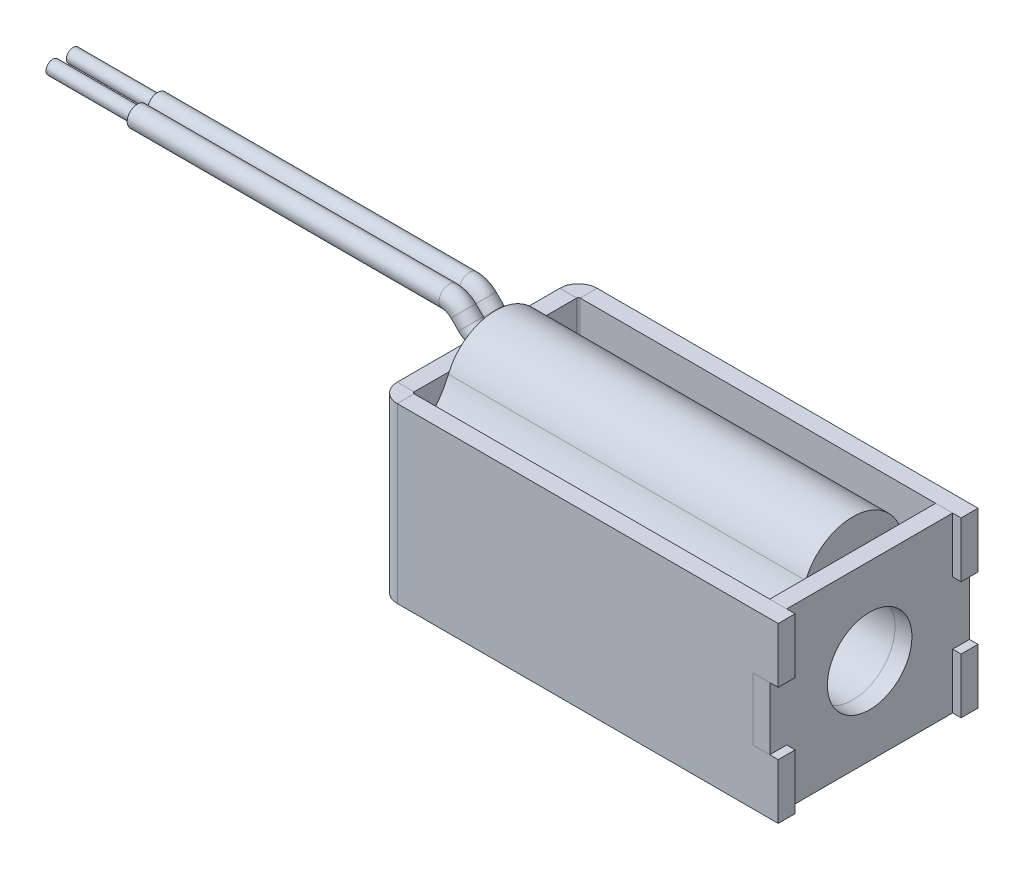
from build123d import *

# Parameters (mm, degrees)
T_LE_DE_BASE_PLI_E1_DEPTH = 6.5
ESQUISSE6_W               = 1.27
ESQUISSE6_H               = 4.699
ENL_V_MAT_EXTRU_1_DEPTH   = 1.905
BOSS_EXTRU_1_DEPTH        = 1.27
BOSS_EXTRU_2_DEPTH        = 26.825
CONG_1_R                  = 6.35
ESQUISSE9_R               = 0.762
ESQUISSE13_R              = 1.651
ENL_V_MAT_EXTRU_2_DEPTH   = 33.343199779
BOSS_EXTRU_3_START        = 0.381
ESQUISSE14_R              = 2.4765
ESQUISSE14_R_2            = 1.651
BOSS_EXTRU_3_DEPTH        = 0.381
ESQUISSE15_R              = 3.175
ENL_V_MAT_EXTRU_3_DEPTH   = 20
ESQUISSE17_R              = 0.508
BOSS_EXTRU_4_DEPTH        = 6.35
ESQUISSE19_R              = 1.143
ENL_V_MAT_EXTRU_7_DEPTH   = 1.27


# Read off the part's stored shape, not the designer's step: Boss.-Extru.2
# Sheet-metal steps are written as plain solids
with BuildPart() as part:
    # Esquisse1 → Tôle de base pliée1 (new, symmetric)
    with BuildSketch(Plane(origin=(0, 0, 0), x_dir=(1, 0, 0), z_dir=(0, 1, 0))):
        with BuildLine():
            Line((15, 7.5), (-13.603, 7.5))
            ThreePointArc((-13.603, 7.5), (-14.590828173, 7.090828173), (-15, 6.103))
            Line((-15, 6.103), (-15, -6.103))
            ThreePointArc((-15, -6.103), (-14.590828173, -7.090828173), (-13.603, -7.5))
            Line((-13.603, -7.5), (15, -7.5))
            Line((15, -7.5), (15, -6.23))
            Line((15, -6.23), (-13.603, -6.23))
            ThreePointArc((-13.603, -6.23), (-13.692802561, -6.192802561), (-13.73, -6.103))
            Line((-13.73, -6.103), (-13.73, 6.103))
            ThreePointArc((-13.73, 6.103), (-13.692802561, 6.192802561), (-13.603, 6.23))
            Line((-13.603, 6.23), (15, 6.23))
            Line((15, 6.23), (15, 7.5))
        make_face()
    extrude(amount=T_LE_DE_BASE_PLI_E1_DEPTH, both=True)

    # Esquisse6 → Enlèv. mat.-Extru.1 (cut)
    with BuildSketch(Plane(origin=(15, 0, 0), x_dir=(0, 0, -1), z_dir=(1, 0, 0))):
        with Locations((-6.865, 0)):
            Rectangle(ESQUISSE6_W, ESQUISSE6_H)
        with Locations((6.865, 0)):
            Rectangle(ESQUISSE6_W, ESQUISSE6_H)
    extrude(amount=-ENL_V_MAT_EXTRU_1_DEPTH, mode=Mode.SUBTRACT)


with BuildPart() as body_2:
    # Esquisse7 → Boss.-Extru.1 (new body)
    with BuildSketch(Plane(origin=(13.095, 0, 0), x_dir=(0, 0, -1), z_dir=(1, 0, 0))):
        Polygon((-7.5, 2.3495), (-6.23, 2.3495), (-6.23, 6.5), (6.23, 6.5), (6.23, 2.3495), (7.5, 2.3495), (7.5, -2.3495), (6.23, -2.3495), (6.23, -6.5), (-6.23, -6.5), (-6.23, -2.3495), (-7.5, -2.3495), align=None)
    extrude(amount=BOSS_EXTRU_1_DEPTH)


with BuildPart() as body_3:
    # Boss.-Extru.2 outline → Boss.-Extru.2 (new body)
    with BuildSketch(Plane(origin=(-13.73, 0, 0), x_dir=(0, 0, -1), z_dir=(1, 0, 0))):
        with BuildLine():
            ThreePointArc((6.103, 2.2368261), (5.176867338, 3.93065447), (3.794095002, 5.277768763))
            ThreePointArc((3.794095002, 5.277768763), (0, 8.74), (-3.794095002, 5.277768763))
            ThreePointArc((-3.794095002, 5.277768763), (-5.176867338, 3.93065447), (-6.103, 2.2368261))
            Line((-6.103, 2.2368261), (-6.103, -2.2368261))
            ThreePointArc((-6.103, -2.2368261), (0, -6.5), (6.103, -2.2368261))
            Line((6.103, -2.2368261), (6.103, 2.2368261))
        make_face()
    extrude(amount=BOSS_EXTRU_2_DEPTH)

    # Congé1
    cong_1_edges = [body_3.edges().sort_by_distance(p)[0] for p in [
        (-0.3175, 5.277768763, -3.794095002),
        (-0.3175, 5.277768763, 3.794095002),
    ]]
    fillet(cong_1_edges, radius=CONG_1_R)


with BuildPart() as body_4:
    # Balayage2: sweep along a path in Esquisse10
    with BuildLine(Plane.XY) as balayage2_path:
        Line((-39.855830676, 8.716004539), (-16.446527477, 8.716004539))
        ThreePointArc((-16.446527477, 8.716004539), (-15.863317926, 8.599996946), (-15.368896742, 8.269635273))
        Line((-15.368896742, 8.269635273), (-14.807630735, 7.708369265))
        ThreePointArc((-14.807630735, 7.708369265), (-14.313209551, 7.378007592), (-13.73, 7.262))
    # Esquisse9 → Balayage2 (sweep)
    with BuildSketch(Plane.ZY.offset(13.73)):
        with Locations((0.762, 7.262)):
            Circle(ESQUISSE9_R)
    sweep(path=balayage2_path.line)


with BuildPart() as body_5:
    # Symétrie1: mirrored copy
    add(body_4.part.mirror(Plane.XY))


with BuildPart() as enl_v_mat_extru_2_tool:
    # Esquisse13 → Enlèv. mat.-Extru.2 (new, through all)
    with BuildSketch(Plane.ZY.offset(15)):
        Circle(ESQUISSE13_R)
    extrude(amount=-ENL_V_MAT_EXTRU_2_DEPTH)


with BuildPart() as part_1:
    add(part.part)

    # Enlèv. mat.-Extru.2: cut by enl_v_mat_extru_2_tool
    add(enl_v_mat_extru_2_tool.part, mode=Mode.SUBTRACT)

    # Esquisse14 → Boss.-Extru.3 (add)
    with BuildSketch(Plane.ZY.offset(15).offset(BOSS_EXTRU_3_START)):
        with Locations(Location((0, 0, 0), (0, 0, 180))):
            Circle(ESQUISSE14_R)
        Circle(ESQUISSE14_R_2, mode=Mode.SUBTRACT)
    extrude(amount=-BOSS_EXTRU_3_DEPTH)

    # Esquisse19 → Enlèv. mat.-Extru.7 (cut)
    with BuildSketch(Plane(origin=(0, 0, -7.5), x_dir=(-1, 0, 0), z_dir=(0, 0, -1))):
        with Locations((-7.5, 0)):
            Circle(ESQUISSE19_R)
        with Locations((7.5, 0)):
            Circle(ESQUISSE19_R)
    extrude(amount=-ENL_V_MAT_EXTRU_7_DEPTH, mode=Mode.SUBTRACT)


with BuildPart() as body_2_1:
    add(body_2.part)

    # Enlèv. mat.-Extru.2: cut by enl_v_mat_extru_2_tool
    add(enl_v_mat_extru_2_tool.part, mode=Mode.SUBTRACT)


with BuildPart() as body_3_1:
    add(body_3.part)

    # Enlèv. mat.-Extru.2: cut by enl_v_mat_extru_2_tool
    add(enl_v_mat_extru_2_tool.part, mode=Mode.SUBTRACT)


with BuildPart() as enl_v_mat_extru_3_tool:
    # Esquisse15 → Enlèv. mat.-Extru.3 (new body)
    with BuildSketch(Plane(origin=(14.365, 0, 0), x_dir=(0, 0, -1), z_dir=(1, 0, 0))):
        Circle(ESQUISSE15_R)
    extrude(amount=-ENL_V_MAT_EXTRU_3_DEPTH)


with BuildPart() as body_2_2:
    add(body_2_1.part)

    # Enlèv. mat.-Extru.3: cut by enl_v_mat_extru_3_tool
    add(enl_v_mat_extru_3_tool.part, mode=Mode.SUBTRACT)


with BuildPart() as body_3_2:
    add(body_3_1.part)

    # Enlèv. mat.-Extru.3: cut by enl_v_mat_extru_3_tool
    add(enl_v_mat_extru_3_tool.part, mode=Mode.SUBTRACT)


with BuildPart() as body_4_1:
    add(body_4.part)

    add(body_5.part)  # Boss.-Extru.4 merges body 5
    # Esquisse17 → Boss.-Extru.4 (add)
    with BuildSketch(Plane.ZY.offset(39.855830676)):
        with Locations(Location((-0.762, 8.716004539, 0), (0, 0, 270))):
            Circle(ESQUISSE17_R)
        with Locations(Location((0.762, 8.716004539, 0), (0, 0, 270))):
            Circle(ESQUISSE17_R)
    extrude(amount=BOSS_EXTRU_4_DEPTH)


solid = Compound([part_1.part, body_2_2.part, body_3_2.part, body_4_1.part])
